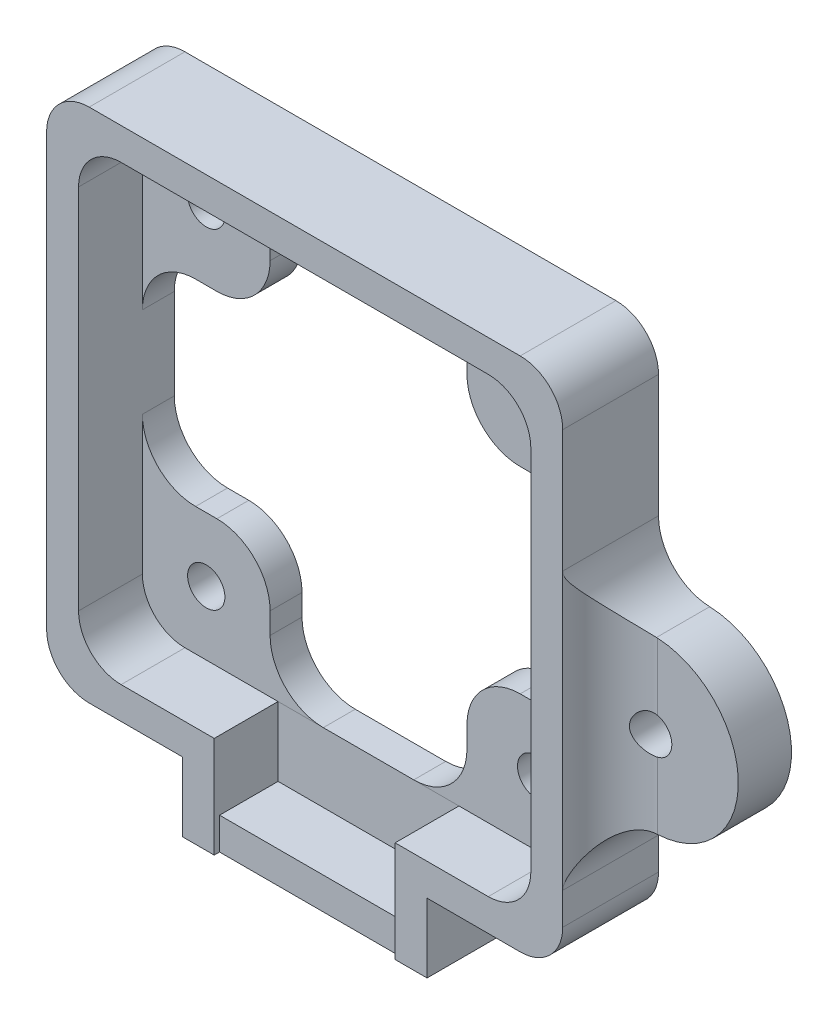
from build123d import *

# Parameters (mm, degrees)
BOSS_EXTRUDE3_DEPTH = 6
BOSS_EXTRUDE4_DEPTH = 3
SKETCH5_W           = 17
SKETCH5_H           = 5.5
CUT_EXTRUDE1_DEPTH  = 3
SKETCH6_R           = 1.75
CUT_EXTRUDE2_DEPTH  = 41.182396643
SKETCH7_R           = 1.75
BOSS_EXTRUDE5_DEPTH = 5
FILLET1_START       = -17.240381157
FILLET1_DEPTH       = 25.980762314
FILLET1_START_2     = 2
FILLET1_2_DEPTH     = 4.000072473
FILLET1_START_3     = -3
FILLET1_3_DEPTH     = 5
FILLET2_R           = 4
FILLET3_R           = 5


with BuildPart() as part:
    # Sketch1 → Boss-Extrude3 (new body)
    with BuildSketch(Plane.XY):
        Polygon((-24.25, 24.25), (24.25, 24.25), (24.25, -24.25), (11.5, -24.25), (11.5, -30.75), (-11.5, -30.75), (-11.5, -24.25), (-24.25, -24.25), align=None)
        Polygon((-21.25, 21.25), (21.25, 21.25), (21.25, -21.25), (8.5, -21.25), (8.5, -27.75), (-8.5, -27.75), (-8.5, -21.25), (-21.25, -21.25), align=None, mode=Mode.SUBTRACT)
    extrude(amount=BOSS_EXTRUDE3_DEPTH)

    # Sketch4 → Boss-Extrude4 (add)
    with BuildSketch(Plane(origin=(0, 0, 0), x_dir=(-1, 0, 0), z_dir=(0, 0, -1))):
        Polygon((-24.25, -24.25), (-24.25, 24.25), (24.25, 24.25), (24.25, -24.25), (11.5, -24.25), (11.5, -30.75), (-11.5, -30.75), (-11.5, -24.25), align=None)
        Polygon((-9.25, 21.25), (9.25, 21.25), (9.25, 9.25), (21.25, 9.25), (21.25, -9.25), (9.25, -9.25), (9.25, -21.25), (-9.25, -21.25), (-9.25, -9.25), (-21.25, -9.25), (-21.25, 9.25), (-9.25, 9.25), align=None, mode=Mode.SUBTRACT)
    extrude(amount=BOSS_EXTRUDE4_DEPTH)

    # Sketch5 → Cut-Extrude1 (cut)
    with BuildSketch(Plane.XZ.offset(30.75)):
        with Locations((0, 8.25)):
            Rectangle(SKETCH5_W, SKETCH5_H)
    extrude(amount=-CUT_EXTRUDE1_DEPTH, mode=Mode.SUBTRACT)

    # Sketch6 → Cut-Extrude2 (cut, through all)
    with BuildSketch(Plane(origin=(0, 0, -3), x_dir=(-1, 0, 0), z_dir=(0, 0, -1))):
        with Locations((-15.75, 15.75)):
            Circle(SKETCH6_R)
        with Locations((15.25, 15.75)):
            Circle(SKETCH6_R)
        with Locations((15.25, -15.25)):
            Circle(SKETCH6_R)
        with Locations((-15.75, -15.25)):
            Circle(SKETCH6_R)
    extrude(amount=-CUT_EXTRUDE2_DEPTH, mode=Mode.SUBTRACT)

    # Sketch7 → Boss-Extrude5 (add)
    with BuildSketch(Plane(origin=(0, 0, -3), x_dir=(-1, 0, 0), z_dir=(0, 0, -1))):
        with BuildLine():
            Line((-28.75, 3.75), (-24.25, 3.75))
            Line((-24.25, 3.75), (-24.25, -12.25))
            Line((-24.25, -12.25), (-28.75, -12.25))
            ThreePointArc((-28.75, -12.25), (-36.75, -4.25), (-28.75, 3.75))
        make_face()
        with Locations((-28.75, -4.25)):
            Circle(SKETCH7_R, mode=Mode.SUBTRACT)
    extrude(amount=-BOSS_EXTRUDE5_DEPTH)

    # Fillet1: read off the stored shape, not the designer's step
    # Fillet1 outline → Fillet1 (add)
    with BuildSketch(Plane(origin=(0, 0, 0), x_dir=(1, 0, 0), z_dir=(0, 1, 0)).offset(FILLET1_START)):
        with BuildLine():
            ThreePointArc((24.249985207, -6.000072473), (25.986673178, -3.127040044), (29.148979486, -2))
            Line((29.148979486, -2), (24.25, -2))
            Line((24.25, -2), (24.249985207, -6.000072473))
        make_face()
    extrude(amount=FILLET1_DEPTH)

    # Fillet1 2 outline → Fillet1 2 (cut)
    with BuildSketch(Plane.XY.offset(FILLET1_START_2)):
        with BuildLine():
            ThreePointArc((29.057692308, -12.24408065), (25.647116539, -13.77350483), (24.25, -17.240381057))
            Line((24.25, -17.240381057), (29.148979486, -17.240381157))
            Line((29.148979486, -17.240381157), (29.148979486, -12.240044766))
            ThreePointArc((29.148979486, -12.240044766), (29.103341659, -12.242193045), (29.057692308, -12.24408065))
        make_face()
        with BuildLine():
            ThreePointArc((29.057692308, 3.74408065), (29.103341659, 3.742193045), (29.148979486, 3.740044766))
            Line((29.148979486, 3.740044766), (29.148979486, 8.740381157))
            Line((29.148979486, 8.740381157), (24.25, 8.740381057))
            ThreePointArc((24.25, 8.740381057), (25.647116539, 5.27350483), (29.057692308, 3.74408065))
        make_face()
        with BuildLine():
            Line((29.148979486, -5.953911785), (29.148979486, -2.546088215))
            ThreePointArc((29.148979486, -2.546088215), (27, -4.25), (29.148979486, -5.953911785))
        make_face()
    extrude(amount=FILLET1_2_DEPTH, mode=Mode.SUBTRACT)

    # Fillet1 3 outline → Fillet1 3 (add)
    with BuildSketch(Plane.XY.offset(FILLET1_START_3)):
        with BuildLine():
            Line((24.25, -12.25), (24.25, -17.240381057))
            ThreePointArc((24.25, -17.240381057), (25.647116539, -13.77350483), (29.057692308, -12.24408065))
            ThreePointArc((29.057692308, -12.24408065), (28.90387462, -12.248520026), (28.75, -12.25))
            Line((28.75, -12.25), (24.25, -12.25))
        make_face()
        with BuildLine():
            ThreePointArc((28.75, 3.75), (28.90387462, 3.748520026), (29.057692308, 3.74408065))
            ThreePointArc((29.057692308, 3.74408065), (25.647116539, 5.27350483), (24.25, 8.740381057))
            Line((24.25, 8.740381057), (24.25, 3.75))
            Line((24.25, 3.75), (28.75, 3.75))
        make_face()
    extrude(amount=FILLET1_3_DEPTH)

    # Fillet2
    fillet2_edges = [part.edges().sort_by_distance(p)[0] for p in [
        (-24.25, 24.25, 1.5),
        (24.25, 24.25, 1.5),
        (24.25, -24.25, 1.5),
        (-24.25, -24.25, 1.5),
        (21.25, -21.25, 3),
        (21.25, 21.25, 3),
        (-21.25, 21.25, 3),
        (-21.25, -21.25, 3),
    ]]
    fillet(fillet2_edges, radius=FILLET2_R)

    # Fillet3
    # the kernel refuses this fillet: 5 mm, written as the material it adds along each edge
    with BuildSketch(Plane(origin=(21.25, 9.25, 0), x_dir=(0, -1, 0), z_dir=(0, 0, -1)), Plane(origin=(9.25, -21.25, 0), x_dir=(-1, 0, 0), z_dir=(0, 0, -1)), Plane(origin=(-21.25, -9.25, 0), x_dir=(0, 1, 0), z_dir=(0, 0, -1)), Plane(origin=(-9.25, 21.25, 0), x_dir=(1, 0, 0), z_dir=(0, 0, -1))) as fillet3_piece_1:
        with BuildLine():
            CenterArc((FILLET3_R, FILLET3_R), FILLET3_R, 180, 90)
            Line((0, FILLET3_R), (0, 0))
            Line((0, 0), (FILLET3_R, 0))
        make_face()
    extrude(amount=3)
    with BuildSketch(Plane(origin=(21.25, -9.25, 0), x_dir=(0, 1, 0), z_dir=(0, 0, -1)), Plane(origin=(-9.25, -21.25, 0), x_dir=(1, 0, 0), z_dir=(0, 0, -1)), Plane(origin=(-21.25, 9.25, 0), x_dir=(0, -1, 0), z_dir=(0, 0, -1)), Plane(origin=(9.25, 21.25, 0), x_dir=(-1, 0, 0), z_dir=(0, 0, -1))) as fillet3_piece_2:
        with BuildLine():
            CenterArc((FILLET3_R, -FILLET3_R), FILLET3_R, 90, 90)
            Line((0, -FILLET3_R), (0, 0))
            Line((0, 0), (FILLET3_R, 0))
        make_face()
    extrude(amount=3)
    # the kernel refuses this fillet: 5 mm, written as the material it takes off along each edge
    with BuildSketch(Plane(origin=(9.25, 9.25, 12.5), x_dir=(1, 0, 0), z_dir=(0, 0, -1)), Plane(origin=(9.25, -9.25, 12.5), x_dir=(0, -1, 0), z_dir=(0, 0, -1)), Plane(origin=(-9.25, -9.25, 12.5), x_dir=(-1, 0, 0), z_dir=(0, 0, -1)), Plane(origin=(-9.25, 9.25, 12.5), x_dir=(0, 1, 0), z_dir=(0, 0, -1))) as fillet3_2_piece_1:
        with BuildLine():
            CenterArc((FILLET3_R, -FILLET3_R), FILLET3_R, 90, 90)
            Line((0, -FILLET3_R), (0, 0))
            Line((0, 0), (FILLET3_R, 0))
        make_face()
    extrude(amount=28, mode=Mode.SUBTRACT)


solid = part.part
